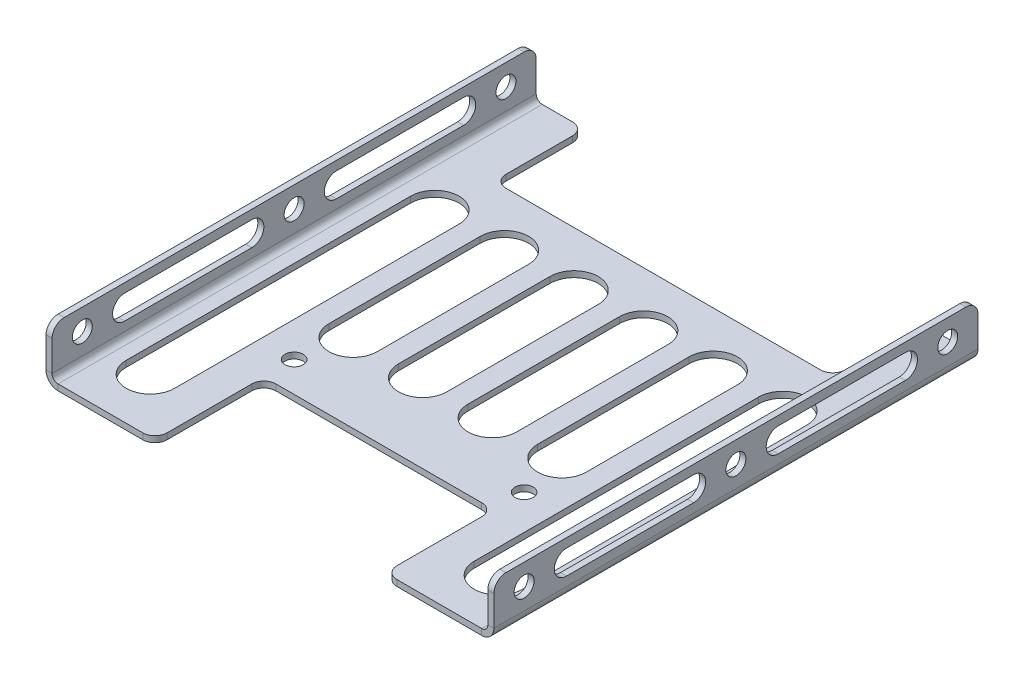
from build123d import *

# Parameters (mm, degrees)
SM_BASE_FLANGE_1_DEPTH   = 40
CUT_EXTRUDE_1_DEPTH      = 56.072679252
CUT_EXTRUDE_1_DEPTH_BACK = 56.072679252
SKETCH_6_R               = 1.65
CUT_EXTRUDE_3_DEPTH      = 56.072679252
CUT_EXTRUDE_3_DEPTH_BACK = 56.072679252
SKETCH_7_R               = 1.5
SKETCH_7_W               = 56
SKETCH_7_H               = 15
SKETCH_7_W_2             = 38
SKETCH_7_H_2             = 18
CUT_EXTRUDE_2_DEPTH      = 10
FILLET_1_R               = 2


# Sheet-metal steps are written as plain solids
with BuildPart() as part:
    # Sketch 1 → 基体-法兰1 (new, symmetric)
    with BuildSketch(Plane.XY):
        with BuildLine():
            Line((-36, 8), (-36, 1))
            ThreePointArc((-36, 1), (-35.707106781, 0.292893219), (-35, 0))
            Line((-35, 0), (35, 0))
            ThreePointArc((35, 0), (35.707106781, 0.292893219), (36, 1))
            Line((36, 1), (36, 8))
            Line((36, 8), (37, 8))
            Line((37, 8), (37, 1))
            ThreePointArc((37, 1), (36.414213562, -0.414213562), (35, -1))
            Line((35, -1), (-35, -1))
            ThreePointArc((-35, -1), (-36.414213562, -0.414213562), (-37, 1))
            Line((-37, 1), (-37, 8))
            Line((-37, 8), (-36, 8))
        make_face()
    extrude(amount=SM_BASE_FLANGE_1_DEPTH, both=True)

    # 草图6 → 切除-拉伸1 (cut, two sides: drawn at the far end of the back side and taken through both)
    with BuildSketch(Plane(origin=(0, 0, 0), x_dir=(0, 0, -1), z_dir=(1, 0, 0)).offset(-CUT_EXTRUDE_1_DEPTH_BACK)):
        with Locations((-35, 4.5)):
            Circle(SKETCH_6_R)
        with Locations((35, 4.5)):
            Circle(SKETCH_6_R)
        with Locations((0, 4.5)):
            Circle(SKETCH_6_R)
    extrude(amount=CUT_EXTRUDE_1_DEPTH + CUT_EXTRUDE_1_DEPTH_BACK, mode=Mode.SUBTRACT)

    # 草图8 → 切除-拉伸3 (cut, two sides: drawn at the far end of the back side and taken through both)
    with BuildSketch(Plane(origin=(0, 0, 0), x_dir=(0, 0, -1), z_dir=(1, 0, 0)).offset(-CUT_EXTRUDE_3_DEPTH_BACK)):
        with BuildLine():
            Line((-28, 6.5), (-7, 6.5))
            ThreePointArc((-7, 6.5), (-5, 4.5), (-7, 2.5))
            Line((-7, 2.5), (-28, 2.5))
            ThreePointArc((-28, 2.5), (-30, 4.5), (-28, 6.5))
        make_face()
        with BuildLine():
            Line((28, 6.5), (7, 6.5))
            ThreePointArc((7, 6.5), (5, 4.5), (7, 2.5))
            Line((7, 2.5), (28, 2.5))
            ThreePointArc((28, 2.5), (30, 4.5), (28, 6.5))
        make_face()
    extrude(amount=CUT_EXTRUDE_3_DEPTH + CUT_EXTRUDE_3_DEPTH_BACK, mode=Mode.SUBTRACT)

    # 草图7 → 切除-拉伸2 (cut)
    with BuildSketch(Plane.XZ.offset(1)):
        with Locations(Location((19, 17, 0), (0, 0, 270))):
            Circle(SKETCH_7_R)
        with Locations(Location((-19, 17, 0), (0, 0, 270))):
            Circle(SKETCH_7_R)
        with BuildLine():
            Line((-24.75, 31), (-24.75, -16))
            ThreePointArc((-24.75, -16), (-28.75, -20), (-32.75, -16))
            Line((-32.75, -16), (-32.75, 31))
            ThreePointArc((-32.75, 31), (-28.75, 35), (-24.75, 31))
        make_face()
        with BuildLine():
            Line((-13.25, 9), (-13.25, -16))
            ThreePointArc((-13.25, -16), (-17.25, -20), (-21.25, -16))
            Line((-21.25, -16), (-21.25, 9))
            ThreePointArc((-21.25, 9), (-17.25, 13), (-13.25, 9))
        make_face()
        with BuildLine():
            Line((-1.75, 9), (-1.75, -16))
            ThreePointArc((-1.75, -16), (-5.75, -20), (-9.75, -16))
            Line((-9.75, -16), (-9.75, 9))
            ThreePointArc((-9.75, 9), (-5.75, 13), (-1.75, 9))
        make_face()
        with BuildLine():
            Line((21.25, 9), (21.25, -16))
            ThreePointArc((21.25, -16), (17.25, -20), (13.25, -16))
            Line((13.25, -16), (13.25, 9))
            ThreePointArc((13.25, 9), (17.25, 13), (21.25, 9))
        make_face()
        with BuildLine():
            Line((32.75, 31), (32.75, -16))
            ThreePointArc((32.75, -16), (28.75, -20), (24.75, -16))
            Line((24.75, -16), (24.75, 31))
            ThreePointArc((24.75, 31), (28.75, 35), (32.75, 31))
        make_face()
        with Locations((0, -32.5)):
            Rectangle(SKETCH_7_W, SKETCH_7_H)
        with BuildLine():
            Line((9.75, 9), (9.75, -16))
            ThreePointArc((9.75, -16), (5.75, -20), (1.75, -16))
            Line((1.75, -16), (1.75, 9))
            ThreePointArc((1.75, 9), (5.75, 13), (9.75, 9))
        make_face()
        with Locations((0, 31)):
            Rectangle(SKETCH_7_W_2, SKETCH_7_H_2)
    extrude(amount=-CUT_EXTRUDE_2_DEPTH, mode=Mode.SUBTRACT)

    # 圆角1
    fillet_1_edges = [part.edges().sort_by_distance(p)[0] for p in [
        (-36.5, 8, -40),
        (36.5, 8, -40),
        (-28, -0.5, -40),
        (-28, -0.5, -25),
        (28, -0.5, -25),
        (28, -0.5, -40),
        (-19, -0.5, 22),
        (-19, -0.5, 40),
        (19, -0.5, 40),
        (19, -0.5, 22),
        (-36.5, 8, 40),
        (36.5, 8, 40),
    ]]
    fillet(fillet_1_edges, radius=FILLET_1_R)


solid = part.part
